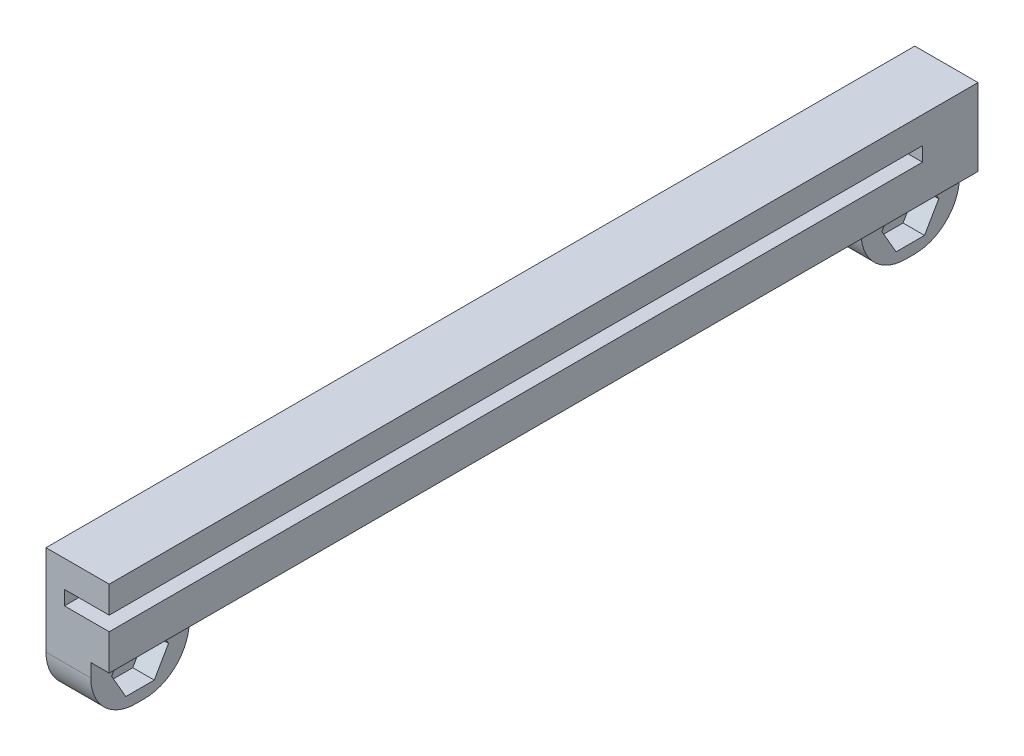
from build123d import *

# Parameters (mm, degrees)
SKETCH1_W           = 7.0575
SKETCH1_H           = 97
BOSS_EXTRUDE2_DEPTH = 7.6
SKETCH4_W           = 5
SKETCH4_H           = 90.805
CUT_EXTRUDE1_DEPTH  = 4.6
SKETCH6_W           = 5
SKETCH6_H           = 90.805
BOSS_EXTRUDE3_DEPTH = 3
SKETCH8_W           = 7.0575
SKETCH8_H           = 97
BOSS_EXTRUDE4_DEPTH = 1
SKETCH9_W           = 5
SKETCH9_H           = 11
BOSS_EXTRUDE5_DEPTH = 6.5
CUT_EXTRUDE2_DEPTH  = 2.4
SKETCH11_R          = 1.6
CUT_EXTRUDE3_DEPTH  = 50.293805962
FILLET2_R           = 5


with BuildPart() as part:
    # Sketch1 → Boss-Extrude2 (new body)
    with BuildSketch(Plane(origin=(0, 0, 0), x_dir=(1, 0, 0), z_dir=(0, 1, 0))):
        Rectangle(SKETCH1_W, SKETCH1_H)
    extrude(amount=BOSS_EXTRUDE2_DEPTH)

    # Sketch4 → Cut-Extrude1 (cut)
    with BuildSketch(Plane(origin=(0, 7.6, 0), x_dir=(1, 0, 0), z_dir=(0, 1, 0))):
        with Locations((1.02875, -3.0975)):
            Rectangle(SKETCH4_W, SKETCH4_H)
    extrude(amount=-CUT_EXTRUDE1_DEPTH, mode=Mode.SUBTRACT)

    # Sketch6 → Boss-Extrude3 (add)
    with BuildSketch(Plane(origin=(0, 7.6, 0), x_dir=(1, 0, 0), z_dir=(0, 1, 0))):
        with Locations((1.02875, -3.0975)):
            Rectangle(SKETCH6_W, SKETCH6_H)
    extrude(amount=-BOSS_EXTRUDE3_DEPTH)

    # Sketch8 → Boss-Extrude4 (add)
    with BuildSketch(Plane.XZ):
        Rectangle(SKETCH8_W, SKETCH8_H)
    extrude(amount=BOSS_EXTRUDE4_DEPTH)

    # Sketch9 → Boss-Extrude5 (add)
    with BuildSketch(Plane.XZ.offset(1)):
        with Locations((-1.02875, 43)):
            Rectangle(SKETCH9_W, SKETCH9_H)
        with Locations((-1.02875, -43)):
            Rectangle(SKETCH9_W, SKETCH9_H)
    extrude(amount=BOSS_EXTRUDE5_DEPTH)

    # Sketch10 → Cut-Extrude2 (cut)
    with BuildSketch(Plane(origin=(1.47125, 0, 0), x_dir=(0, 0, -1), z_dir=(1, 0, 0))):
        Polygon((-44.58771324, -0.75), (-46.175426481, -3.5), (-44.58771324, -6.25), (-41.41228676, -6.25), (-39.824573519, -3.5), (-41.41228676, -0.75), align=None)
        Polygon((46.175426481, -3.5), (44.58771324, -0.75), (41.41228676, -0.75), (39.824573519, -3.5), (41.41228676, -6.25), (44.58771324, -6.25), align=None)
    extrude(amount=-CUT_EXTRUDE2_DEPTH, mode=Mode.SUBTRACT)

    # Sketch11 → Cut-Extrude3 (cut, through all)
    with BuildSketch(Plane(origin=(-0.92875, 0, 0), x_dir=(0, 0, -1), z_dir=(1, 0, 0))):
        with Locations((-43, -3.5)):
            Circle(SKETCH11_R)
        with Locations((43, -3.5)):
            Circle(SKETCH11_R)
    extrude(amount=-CUT_EXTRUDE3_DEPTH, mode=Mode.SUBTRACT)

    # Fillet2
    fillet2_edges = [part.edges().sort_by_distance(p)[0] for p in [
        (-1.02875, -7.5, -48.5),
        (-1.02875, -7.5, -37.5),
        (-1.02875, -7.5, 37.5),
        (-1.02875, -7.5, 48.5),
    ]]
    fillet(fillet2_edges, radius=FILLET2_R)


solid = part.part
